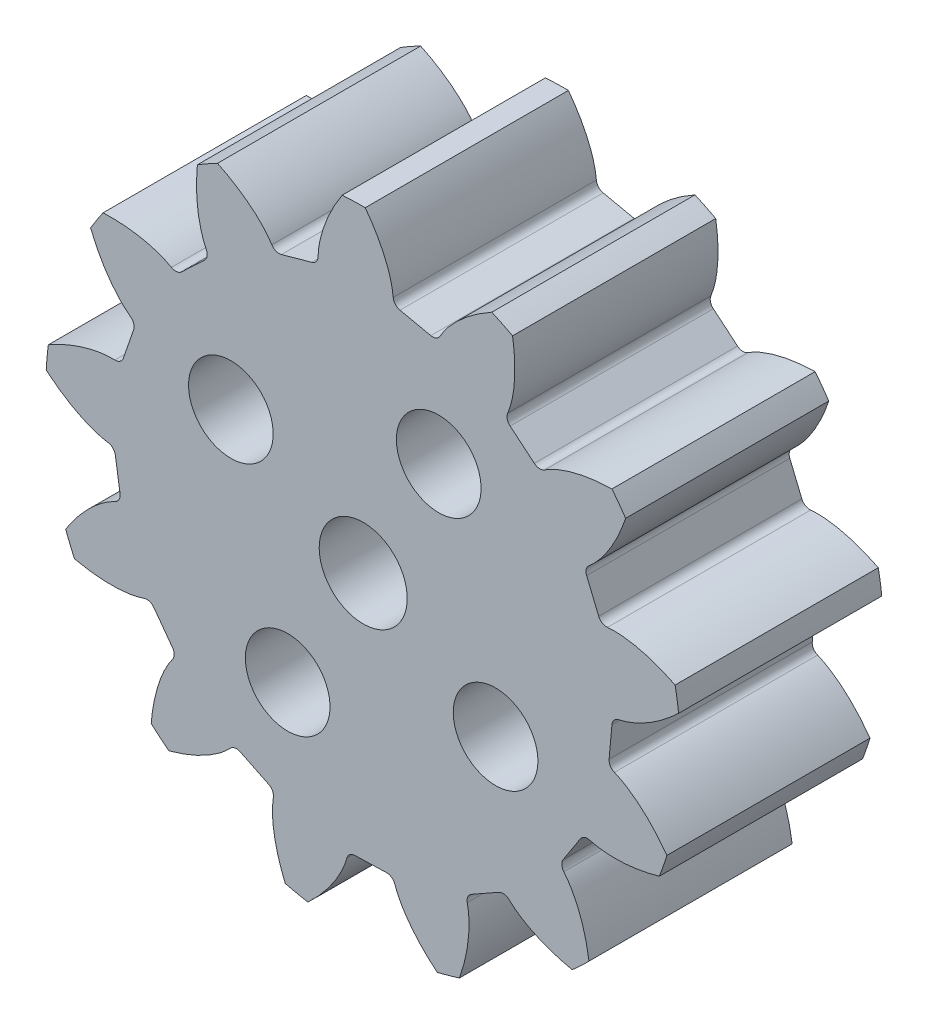
from build123d import *

# Parameters (mm, degrees)
SKETCH2_R                = 9.375
BOSS_EXTRUDE1_DEPTH      = 6
CUT_EXTRUDE1_DEPTH       = 6
FILLET1_R                = 0.254
CIRPATTERN3_COUNT        = 13
FILLET1_OF_CIRPATTERN3_R = 0.254
SKETCH3_R                = 1.3
CUT_EXTRUDE2_DEPTH       = 15.54374549
SKETCH4_R                = 1.25
CUT_EXTRUDE3_DEPTH       = 15.54374549
SKETCH5_R                = 2.1
CUT_EXTRUDE4_DEPTH       = 3


# Read off the part's stored shape, not the designer's step: Cut-Extrude1
with BuildPart() as part:
    # Sketch2 → Boss-Extrude1 (new body)
    with BuildSketch(Plane.XY):
        Circle(SKETCH2_R)
    extrude(amount=BOSS_EXTRUDE1_DEPTH)

    # Cut-Extrude1 outline → Cut-Extrude1 (cut)
    with BuildSketch(Plane.XY):
        with BuildLine():
            add(Edge.make_bspline(
                [(7.36375077, 0), (7.369196033, 0), (7.384464311, 0.000356691), (7.413295798, 0.002439252), (7.460189767, 0.007832738), (7.519640422, 0.017627369), (7.595991175, 0.033624104), (7.685169914, 0.056732319), (7.782202271, 0.086557444), (7.886545951, 0.123735009), (7.989429071, 0.164967118), (8.09080677, 0.209905809), (8.190585497, 0.258078866), (8.30989291, 0.320396761), (8.450705961, 0.400603876), (8.611688186, 0.502157362), (8.789753203, 0.626416136), (8.965954099, 0.762460936), (9.117866368, 0.889741099), (9.225406591, 0.987220267), (9.289799065, 1.047779957), (9.313674205, 1.070559573)],
                knots=[0, 0, 0, 0, 0, 0.005376748, 0.015083688, 0.02853182, 0.046610139, 0.064854849, 0.092110525, 0.119476175, 0.146842495, 0.174208853, 0.201574955, 0.228941013, 0.256307345, 0.307035032, 0.361767351, 0.41649966, 0.471231936, 0.525964281, 0.558682012, 0.558682012, 0.558682012, 0.558682012, 0.558682012], degree=4))
            Line((7.36375077, 0), (7.242514439, -1.330717849))
            add(Edge.make_bspline(
                [(8.966871537, -2.736026286), (8.947506025, -2.709307188), (8.895117565, -2.63810806), (8.806963529, -2.522799977), (8.680553382, -2.370162983), (8.531838369, -2.204516406), (8.37916005, -2.050124943), (8.239180156, -1.921152013), (8.115179827, -1.81681882), (8.009098273, -1.733966647), (7.919667745, -1.668555498), (7.828080081, -1.606036512), (7.734341957, -1.546891035), (7.638434616, -1.491469409), (7.54838955, -1.444600415), (7.464854976, -1.405756987), (7.392652058, -1.376226127), (7.335950201, -1.355849309), (7.29080296, -1.342070321), (7.262822496, -1.334811852), (7.247870052, -1.331701873), (7.242514439, -1.330717849)],
                knots=[0.350408904, 0.350408904, 0.350408904, 0.350408904, 0.350408904, 0.383126635, 0.43785898, 0.492591256, 0.547323565, 0.602055884, 0.652783571, 0.680149903, 0.707515961, 0.734882063, 0.762248421, 0.789614741, 0.816980391, 0.844236067, 0.862480777, 0.880559096, 0.894007228, 0.903714168, 0.909090916, 0.909090916, 0.909090916, 0.909090916, 0.909090916], degree=4))
            ThreePointArc((8.966871537, -2.736026286), (9.336332906, -0.850595595), (9.313674205, 1.070559573))
        make_face()
    cut_extrude1 = extrude(amount=CUT_EXTRUDE1_DEPTH, mode=Mode.SUBTRACT)

    # Fillet1
    fillet1_edges = [part.edges().sort_by_distance(p)[0] for p in [
        (7.242514439, -1.330717849, 3),
        (7.36375077, 0, 3),
    ]]
    fillet(fillet1_edges, radius=FILLET1_R)

    # CirPattern3: Cut-Extrude1 ×13 about axis
    cirpattern3_axis = Axis((0, 0, 18.908609159), (0, 0, -1))
    for i in range(1, CIRPATTERN3_COUNT):
        add(cut_extrude1.rotate(cirpattern3_axis, i * 360 / CIRPATTERN3_COUNT), mode=Mode.SUBTRACT)

    # Fillet1 of CirPattern3
    fillet1_of_cirpattern3_edges = [part.edges().sort_by_distance(p)[0] for p in [
        (5.794512631, -4.544056422, 3),
        (6.520277491, -3.422105616, 3),
        (3.019057811, -6.71640643, 3),
        (4.183087216, -6.060248076, 3),
        (-0.44802677, -7.350108666, 3),
        (0.887602072, -7.310060736, 3),
        (-3.812473818, -6.299989586, 3),
        (-2.61122201, -6.885226577, 3),
        (-6.303529059, -3.806618814, 3),
        (-5.511846598, -4.883069985, 3),
        (-7.350521758, -0.441197547, 3),
        (-7.149773556, -1.762260907, 3),
        (-6.713598506, 3.025296761, 3),
        (-7.149773556, 1.762260907, 3),
        (-4.538670744, 5.79873204, 3),
        (-5.511846598, 4.883069985, 3),
        (-1.323988211, 7.243747691, 3),
        (-2.61122201, 6.885226577, 3),
        (2.194004065, 7.029308043, 3),
        (0.887602072, 7.310060736, 3),
        (5.20937645, 5.204538634, 3),
        (4.183087216, 6.060248076, 3),
        (7.031343471, 2.187472146, 3),
        (6.520277491, 3.422105616, 3),
    ]]
    fillet(fillet1_of_cirpattern3_edges, radius=FILLET1_OF_CIRPATTERN3_R)

    # Sketch3 → Cut-Extrude2 (cut, through all)
    with BuildSketch(Plane(origin=(0, 0, 0), x_dir=(-1, 0, 0), z_dir=(0, 0, -1))):
        Circle(SKETCH3_R)
    extrude(amount=-CUT_EXTRUDE2_DEPTH, mode=Mode.SUBTRACT)

    # Sketch4 → Cut-Extrude3 (cut, through all)
    with BuildSketch(Plane(origin=(0, 0, 0), x_dir=(-1, 0, 0), z_dir=(0, 0, -1))):
        with Locations((-3.908425934, -2.230292967)):
            Circle(SKETCH4_R)
        with Locations((2.230292967, -3.908425934)):
            Circle(SKETCH4_R)
        with Locations((3.908425934, 2.230292967)):
            Circle(SKETCH4_R)
        with Locations((-2.230292967, 3.908425934)):
            Circle(SKETCH4_R)
    extrude(amount=-CUT_EXTRUDE3_DEPTH, mode=Mode.SUBTRACT)

    # Sketch5 → Cut-Extrude4 (cut)
    with BuildSketch(Plane(origin=(0, 0, 0), x_dir=(-1, 0, 0), z_dir=(0, 0, -1))):
        with Locations((-2.230292967, 3.908425934)):
            Circle(SKETCH5_R)
        with Locations((3.908425934, 2.230292967)):
            Circle(SKETCH5_R)
        with Locations((2.230292967, -3.908425934)):
            Circle(SKETCH5_R)
        with Locations((-3.908425934, -2.230292967)):
            Circle(SKETCH5_R)
    extrude(amount=-CUT_EXTRUDE4_DEPTH, mode=Mode.SUBTRACT)


solid = part.part
